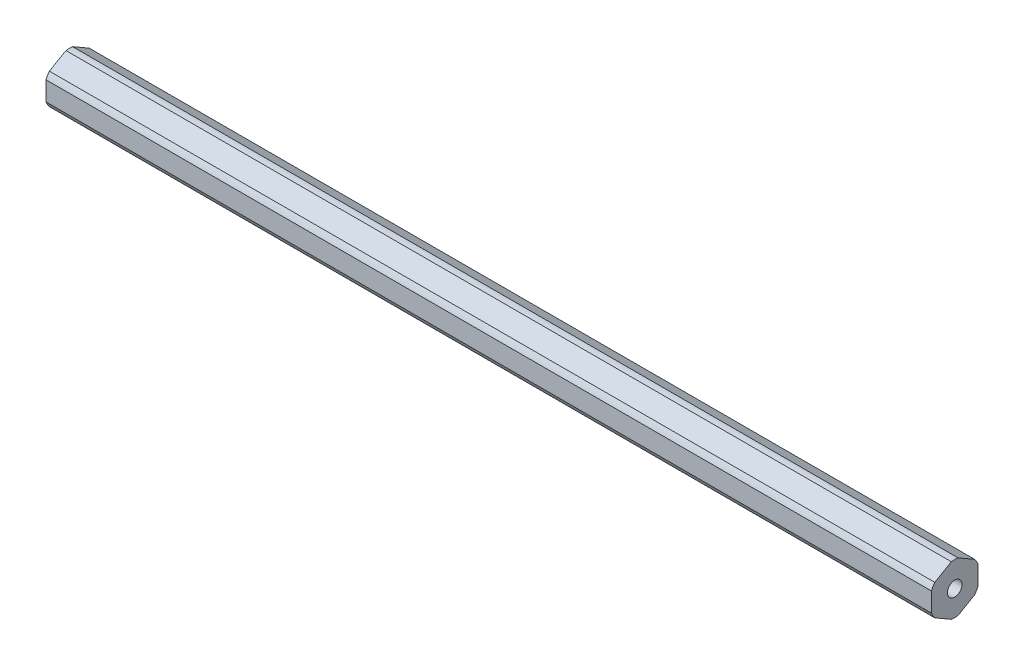
from build123d import *

# Parameters (mm, degrees)
SKETCH1_R           = 1.9939
BOSS_EXTRUDE1_DEPTH = 120.7135


with BuildPart() as part:
    # Sketch1 → Boss-Extrude1 (new, symmetric)
    with BuildSketch(Plane(origin=(914.4, 0, 0), x_dir=(0, 0, -1), z_dir=(1, 0, 0))):
        with BuildLine():
            Line((-5.43426841, -4.194872089), (-0.91573159, -6.803650539))
            ThreePointArc((-0.91573159, -6.803650539), (0, -6.865), (0.91573159, -6.803650539))
            Line((0.91573159, -6.803650539), (5.43426841, -4.194872089))
            ThreePointArc((5.43426841, -4.194872089), (5.945264397, -3.4325), (6.35, -2.60877845))
            Line((6.35, -2.60877845), (6.35, 2.60877845))
            ThreePointArc((6.35, 2.60877845), (5.945264397, 3.4325), (5.43426841, 4.194872089))
            Line((5.43426841, 4.194872089), (0.91573159, 6.803650539))
            ThreePointArc((0.91573159, 6.803650539), (0, 6.865), (-0.91573159, 6.803650539))
            Line((-0.91573159, 6.803650539), (-5.43426841, 4.194872089))
            ThreePointArc((-5.43426841, 4.194872089), (-5.945264397, 3.4325), (-6.35, 2.60877845))
            Line((-6.35, 2.60877845), (-6.35, -2.60877845))
            ThreePointArc((-6.35, -2.60877845), (-5.945264397, -3.4325), (-5.43426841, -4.194872089))
        make_face()
        Circle(SKETCH1_R, mode=Mode.SUBTRACT)
    extrude(amount=BOSS_EXTRUDE1_DEPTH, both=True)


solid = part.part
